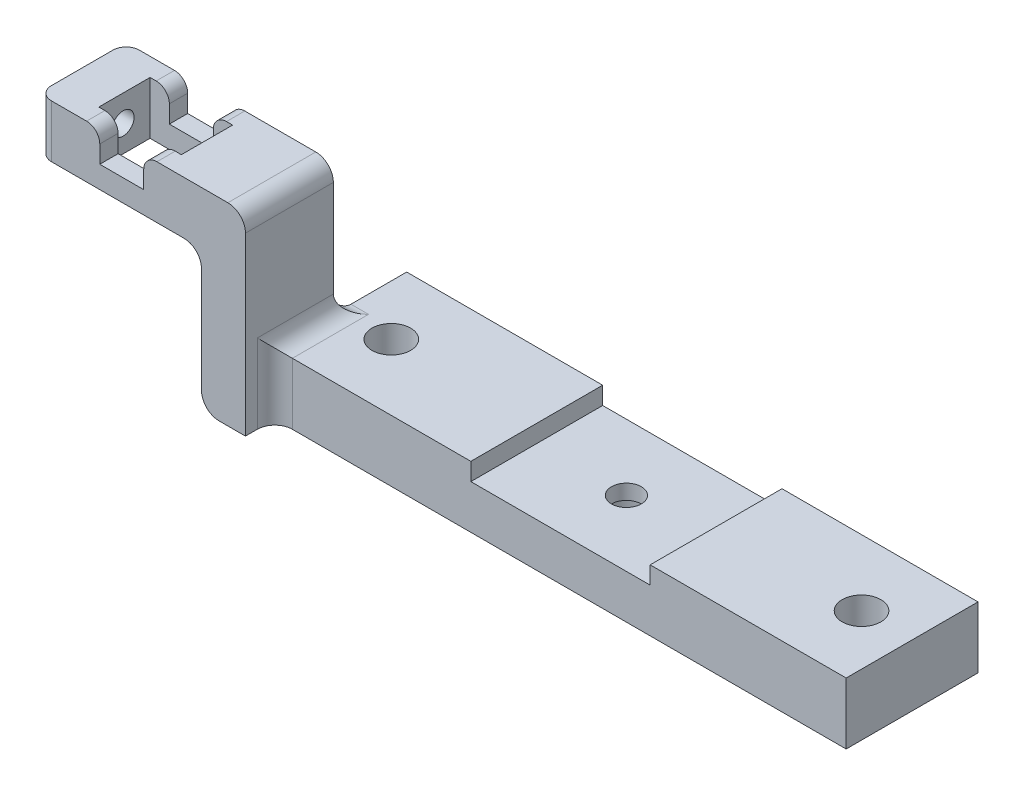
from build123d import *

# Parameters (mm, degrees)
SKETCH1_W                = 65
SKETCH1_H                = 15
BOSS_EXTRUDE1_DEPTH      = 7
SKETCH2_W                = 20.4
SKETCH2_H                = 15
CUT_EXTRUDE1_DEPTH       = 2
SKETCH3_R                = 1.7
CUT_EXTRUDE2_DEPTH       = 68.074585351
SKETCH4_R                = 3
CUT_EXTRUDE3_DEPTH       = 3.3
SKETCH5_R                = 2.2
CUT_EXTRUDE4_DEPTH       = 68.074585351
CHAMFER1_SIZE            = 1
BOSS_EXTRUDE2_DEPTH      = 5
BOSS_EXTRUDE2_DEPTH_BACK = 5
CUT_EXTRUDE5_DEPTH       = 69.600291545
CUT_EXTRUDE5_DEPTH_BACK  = 69.600291545
SKETCH7_W                = 9.39
SKETCH7_H                = 5.83
FILLET1_R                = 1.5
FILLET2_R                = 2
FILLET3_R                = 2
FILLET4_R                = 2
SKETCH8_R                = 1.25
CUT_EXTRUDE6_DEPTH       = 4.805
FILLET5_R                = 2


with BuildPart() as part:
    # Sketch1 → Boss-Extrude1 (new body)
    with BuildSketch(Plane(origin=(0, 0, 0), x_dir=(1, 0, 0), z_dir=(0, 1, 0))):
        with Locations((32.5, 7.5)):
            Rectangle(SKETCH1_W, SKETCH1_H)
    extrude(amount=BOSS_EXTRUDE1_DEPTH)

    # Sketch2 → Cut-Extrude1 (cut)
    with BuildSketch(Plane(origin=(0, 7, 0), x_dir=(1, 0, 0), z_dir=(0, 1, 0))):
        with Locations((32.5, 7.5)):
            Rectangle(SKETCH2_W, SKETCH2_H)
    extrude(amount=-CUT_EXTRUDE1_DEPTH, mode=Mode.SUBTRACT)

    # Sketch3 → Cut-Extrude2 (cut, through all)
    with BuildSketch(Plane(origin=(0, 0, 0), x_dir=(-1, 0, 0), z_dir=(0, -1, 0))):
        with Locations(Location((-32.5, 7.5, 0), (0, 0, 90))):
            Circle(SKETCH3_R)
    extrude(amount=-CUT_EXTRUDE2_DEPTH, mode=Mode.SUBTRACT)

    # Sketch4 → Cut-Extrude3 (cut)
    with BuildSketch(Plane(origin=(0, 0, 0), x_dir=(-1, 0, 0), z_dir=(0, -1, 0))):
        with Locations(Location((-32.5, 7.5, 0), (0, 0, 90))):
            Circle(SKETCH4_R)
    extrude(amount=-CUT_EXTRUDE3_DEPTH, mode=Mode.SUBTRACT)

    # Sketch5 → Cut-Extrude4 (cut, through all)
    with BuildSketch(Plane(origin=(0, 0, 0), x_dir=(-1, 0, 0), z_dir=(0, -1, 0))):
        with Locations(Location((-5.75, 7.5, 0), (0, 0, 90))):
            Circle(SKETCH5_R)
        with Locations(Location((-59.25, 7.5, 0), (0, 0, 90))):
            Circle(SKETCH5_R)
    extrude(amount=-CUT_EXTRUDE4_DEPTH, mode=Mode.SUBTRACT)

    # Chamfer1
    chamfer1_edges = [part.edges().sort_by_distance(p)[0] for p in [
        (5.75, 0, -5.3),
        (59.25, 0, -5.3),
    ]]
    chamfer(chamfer1_edges, length=CHAMFER1_SIZE)

    # Sketch6 → Boss-Extrude2 (add, two sides: drawn at the far end of the back side and taken through both)
    with BuildSketch(Plane.XY.offset(-1.658).offset(-BOSS_EXTRUDE2_DEPTH_BACK)):
        Polygon((-16.575, 22), (-16.575, 18.5), (-11.575, 18.5), (-11.575, 22), (0, 22), (0, 7), (0, 0), (-5, 0), (-5, 16), (-23.575, 16), (-23.575, 22), align=None)
    extrude(amount=BOSS_EXTRUDE2_DEPTH + BOSS_EXTRUDE2_DEPTH_BACK)

    # Sketch7 → Cut-Extrude5 (cut, two sides: drawn at the far end of the back side and taken through both)
    with BuildSketch(Plane.XZ.offset(-16).offset(-CUT_EXTRUDE5_DEPTH_BACK)):
        with Locations((-14.075, -1.658)):
            Rectangle(SKETCH7_W, SKETCH7_H)
    extrude(amount=CUT_EXTRUDE5_DEPTH + CUT_EXTRUDE5_DEPTH_BACK, mode=Mode.SUBTRACT)

    # Fillet1
    fillet1_edges = [part.edges().sort_by_distance(p)[0] for p in [
        (-16.575, 22, -5.6155),
        (-11.575, 22, -5.6155),
        (-23.575, 19, -6.658),
        (-23.575, 19, 3.342),
        (-11.575, 22, 2.2995),
        (-16.575, 22, 2.2995),
    ]]
    fillet(fillet1_edges, radius=FILLET1_R)

    # Fillet2
    fillet2_edges = [part.edges().sort_by_distance(p)[0] for p in [
        (-5, 0, -1.658),
        (-5, 16, -1.658),
    ]]
    fillet(fillet2_edges, radius=FILLET2_R)

    # Fillet3
    fillet3_edges = [part.edges().sort_by_distance(p)[0] for p in [
        (0, 22, -1.658),
    ]]
    fillet(fillet3_edges, radius=FILLET3_R)

    # Fillet4
    fillet4_edges = [part.edges().sort_by_distance(p)[0] for p in [
        (0, 3.5, -6.658),
        (0, 3.5, 0),
    ]]
    fillet(fillet4_edges, radius=FILLET4_R)

    # Sketch8 → Cut-Extrude6 (cut)
    with BuildSketch(Plane.ZY.offset(23.575)):
        with Locations((-1.508, 19)):
            Circle(SKETCH8_R)
    extrude(amount=-CUT_EXTRUDE6_DEPTH, mode=Mode.SUBTRACT)

    # Fillet5
    fillet5_edges = [part.edges().sort_by_distance(p)[0] for p in [
        (-1, 7, -6.658),
        (0, 7, -2.329),
    ]]
    fillet(fillet5_edges, radius=FILLET5_R - 0.0001)  # a hair under: the kernel refuses the full size


solid = part.part
